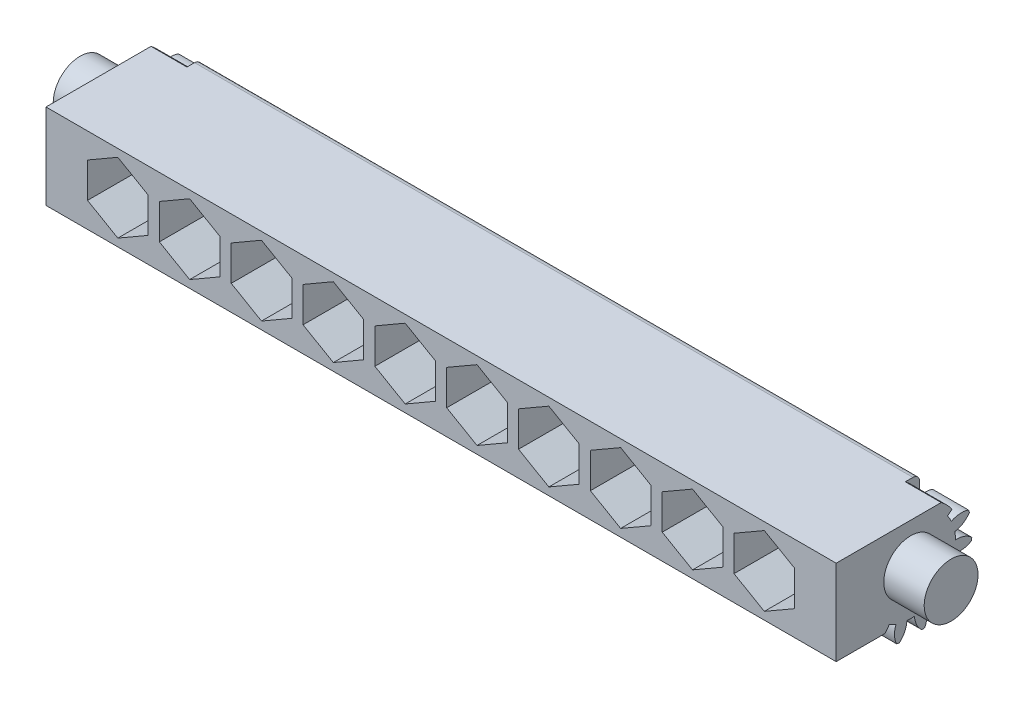
from build123d import *

# Parameters (mm, degrees)
SKETCH1_W           = 8
SKETCH1_H           = 9.5
SKETCH1_R           = 3.325
BOSS_EXTRUDE1_DEPTH = 0.5
BOSS_EXTRUDE2_START = 0.5
SKETCH1_3_W         = 8
SKETCH1_3_H         = 9.5
SKETCH1_3_R         = 3.325
BOSS_EXTRUDE2_DEPTH = 1.8
BOSS_EXTRUDE3_START = 2.3
SKETCH1_4_W         = 8
SKETCH1_4_H         = 9.5
BOSS_EXTRUDE3_DEPTH = 11
LPATTERN12_COUNT    = 10
LPATTERN12_PITCH    = 8
BOSS_EXTRUDE4_DEPTH = 4
CUT_EXTRUDE1_DEPTH  = 4
CIRPATTERN1_START   = -8
CIRPATTERN1_DEPTH   = 4
SKETCH11_R          = 3
BOSS_EXTRUDE5_DEPTH = 4.5
FILLET1_R           = 0.75


# Read off the part's stored shape, not the designer's step: CirPattern1
with BuildPart() as part:
    # Sketch1 → Boss-Extrude1 (new body)
    # profile 1 of 3: a face of its own
    with BuildSketch(Plane.XY):
        Rectangle(SKETCH1_W, SKETCH1_H)
        Polygon((0, -3.897114317), (3.375, -1.948557159), (3.375, 1.948557159), (0, 3.897114317), (-3.375, 1.948557159), (-3.375, -1.948557159), align=None, mode=Mode.SUBTRACT)
    # profile 2 of 3: a face of its own
    with BuildSketch(Plane.XY):
        Polygon((-3.375, -1.948557159), (0, -3.897114317), (3.375, -1.948557159), (3.375, 1.948557159), (0, 3.897114317), (-3.375, 1.948557159), align=None)
        Circle(SKETCH1_R, mode=Mode.SUBTRACT)
    # profile 3 of 3: a face of its own
    with BuildSketch(Plane.XY):
        Circle(SKETCH1_R)
    boss_extrude1 = extrude(amount=BOSS_EXTRUDE1_DEPTH)

    # Sketch1<3> → Boss-Extrude2 (add)
    with BuildSketch(Plane.XY.offset(BOSS_EXTRUDE2_START)):
        Rectangle(SKETCH1_3_W, SKETCH1_3_H)
        Circle(SKETCH1_3_R, mode=Mode.SUBTRACT)
    boss_extrude2 = extrude(amount=BOSS_EXTRUDE2_DEPTH)

    # Sketch1<4> → Boss-Extrude3 (add)
    with BuildSketch(Plane.XY.offset(BOSS_EXTRUDE3_START)):
        Rectangle(SKETCH1_4_W, SKETCH1_4_H)
        Polygon((0, -3.897114317), (3.375, -1.948557159), (3.375, 1.948557159), (0, 3.897114317), (-3.375, 1.948557159), (-3.375, -1.948557159), align=None, mode=Mode.SUBTRACT)
    boss_extrude3 = extrude(amount=BOSS_EXTRUDE3_DEPTH)

    # LPattern12: Boss-Extrude1, Boss-Extrude2, Boss-Extrude3 ×10
    with Locations(*[(i * LPATTERN12_PITCH, 0, 0) for i in range(1, LPATTERN12_COUNT)]):
        add(boss_extrude1)
        add(boss_extrude2)
        add(boss_extrude3)

    # Sketch9 → Boss-Extrude4 (add)
    with BuildSketch(Plane.ZY.offset(4)):
        with BuildLine():
            Line((0.117213911, 3.069077863), (-0.910969791, 3.6627))
            ThreePointArc((-0.910969791, 3.6627), (-0.072260692, -4.317084041), (7.776140284, -5.985313167))
            Line((7.776140284, -5.985313167), (7.293244533, -4.900711553))
            ThreePointArc((7.293244533, -4.900711553), (7.450547444, -4.827757104), (7.605532572, -4.75))
            Line((7.605532572, -4.75), (13.3, -4.75))
            Line((13.3, -4.75), (13.3, 4.75))
            Line((13.3, 4.75), (1.60311908, 4.75))
            ThreePointArc((1.60311908, 4.75), (0.775713521, 3.984193853), (0.117213911, 3.069077863))
        make_face()
    boss_extrude4 = extrude(amount=BOSS_EXTRUDE4_DEPTH)

    # Sketch8 → Cut-Extrude1 (cut)
    with BuildSketch(Plane(origin=(-4, 0, 0), x_dir=(0, 0, -1), z_dir=(1, 0, 0))):
        with BuildLine():
            ThreePointArc((-5.424668738, -4.730929377), (-5, -4.749), (-4.575331262, -4.730929377))
            ThreePointArc((-4.575331262, -4.730929377), (-4.335072011, -5.681738726), (-3.734544115, -6.45706393))
            ThreePointArc((-3.734544115, -6.45706393), (-5, -6.5754), (-6.265455885, -6.45706393))
            ThreePointArc((-6.265455885, -6.45706393), (-5.664927989, -5.681738726), (-5.424668738, -4.730929377))
        make_face()
    cut_extrude1 = extrude(amount=-CUT_EXTRUDE1_DEPTH, mode=Mode.SUBTRACT)

    # CirPattern1 outline → CirPattern1 (cut)
    with BuildSketch(Plane.YZ.offset(CIRPATTERN1_START)):
        with BuildLine():
            ThreePointArc((2.372690774, 0.474054256), (2.640024833, -0.46950042), (2.507615021, -1.441215691))
            ThreePointArc((2.507615021, -1.441215691), (3.097526697, -1.203037713), (3.6627, -0.910969791))
            Line((3.6627, -0.910969791), (3.069077863, 0.117213911))
            ThreePointArc((3.069077863, 0.117213911), (3.298605355, 0.257131102), (3.521203007, 0.407829394))
            ThreePointArc((3.521203007, 0.407829394), (3.298245559, 0.639416387), (3.108238604, 0.898722994))
            ThreePointArc((3.108238604, 0.898722994), (2.749500001, 0.670739006), (2.372690774, 0.474054256))
        make_face()
        with BuildLine():
            ThreePointArc((0.348306535, 0.001966704), (0.20875009, -0.968747942), (-0.3074445, -1.802598091))
            ThreePointArc((-0.3074445, -1.802598091), (0.963448573, -1.788009745), (2.209602671, -1.538045773))
            ThreePointArc((2.209602671, -1.538045773), (1.531320978, -0.82974014), (1.192991252, 0.090746645))
            ThreePointArc((1.192991252, 0.090746645), (0.772537788, 0.028385045), (0.348306535, 0.001966704))
        make_face()
        with BuildLine():
            ThreePointArc((-1.693075796, 0.394084515), (-2.21539217, -0.43594472), (-3.026116802, -0.987749482))
            ThreePointArc((-3.026116802, -0.987749482), (-1.859164593, -1.491341146), (-0.619076671, -1.76984423))
            ThreePointArc((-0.619076671, -1.76984423), (-0.950623976, -0.846892817), (-0.885307855, 0.131624801))
            ThreePointArc((-0.885307855, 0.131624801), (-1.294775955, 0.245668475), (-1.693075796, 0.394084515))
        make_face()
        with BuildLine():
            ThreePointArc((-6.391915066, 6.571957192), (-5.439363547, 6.805213553), (-4.473033744, 6.637972298))
            ThreePointArc((-4.473033744, 6.637972298), (-4.316813743, 7.033276479), (-4.127577071, 7.413880691))
            ThreePointArc((-4.127577071, 7.413880691), (-4.456637753, 7.611429987), (-4.75, 7.858907761))
            Line((-4.75, 7.858907761), (-4.75, 7.605532572))
            ThreePointArc((-4.75, 7.605532572), (-4.827757104, 7.450547444), (-4.900711553, 7.293244533))
            Line((-4.900711553, 7.293244533), (-5.985313167, 7.776140284))
            ThreePointArc((-5.985313167, 7.776140284), (-6.216704413, 7.183533648), (-6.391915066, 6.571957192))
        make_face()
        with BuildLine():
            ThreePointArc((-2.767301919, 1.014289257), (-3.094983901, 1.285019017), (-3.39848267, 1.582606957))
            ThreePointArc((-3.39848267, 1.582606957), (-4.213245725, 1.036782728), (-5.178318747, 0.86243541))
            ThreePointArc((-5.178318747, 0.86243541), (-4.317084041, -0.072260692), (-3.297484762, -0.831075117))
            ThreePointArc((-3.297484762, -0.831075117), (-3.224970136, 0.146935391), (-2.767301919, 1.014289257))
        make_face()
        with BuildLine():
            ThreePointArc((-4.473033744, 3.362027702), (-5.439363547, 3.194786447), (-6.391915066, 3.428042808))
            ThreePointArc((-6.391915066, 3.428042808), (-5.985313167, 2.223859717), (-5.362500509, 1.115939857))
            ThreePointArc((-5.362500509, 1.115939857), (-4.898462391, 1.979902559), (-4.127577071, 2.586119309))
            ThreePointArc((-4.127577071, 2.586119309), (-4.316813743, 2.966723521), (-4.473033744, 3.362027702))
        make_face()
    cirpattern1 = extrude(amount=CIRPATTERN1_DEPTH, mode=Mode.SUBTRACT)

    # Sketch11 → Boss-Extrude5 (add)
    with BuildSketch(Plane.ZY.offset(8)):
        with Locations((5, 0.25)):
            Circle(SKETCH11_R)
    boss_extrude5 = extrude(amount=BOSS_EXTRUDE5_DEPTH)

    # Mirror1: Boss-Extrude4, Cut-Extrude1, CirPattern1, Boss-Extrude5 across plane
    add(boss_extrude4.mirror(Plane.ZY.offset(-36)))
    add(cut_extrude1.mirror(Plane.ZY.offset(-36)), mode=Mode.SUBTRACT)
    add(cirpattern1.mirror(Plane.ZY.offset(-36)), mode=Mode.SUBTRACT)
    add(boss_extrude5.mirror(Plane.ZY.offset(-36)))

    # Fillet1
    fillet1_edges = [part.edges().sort_by_distance(p)[0] for p in [
        (36, 4.75, 0),
        (36, -4.75, 0),
    ]]
    fillet(fillet1_edges, radius=FILLET1_R)


solid = part.part
